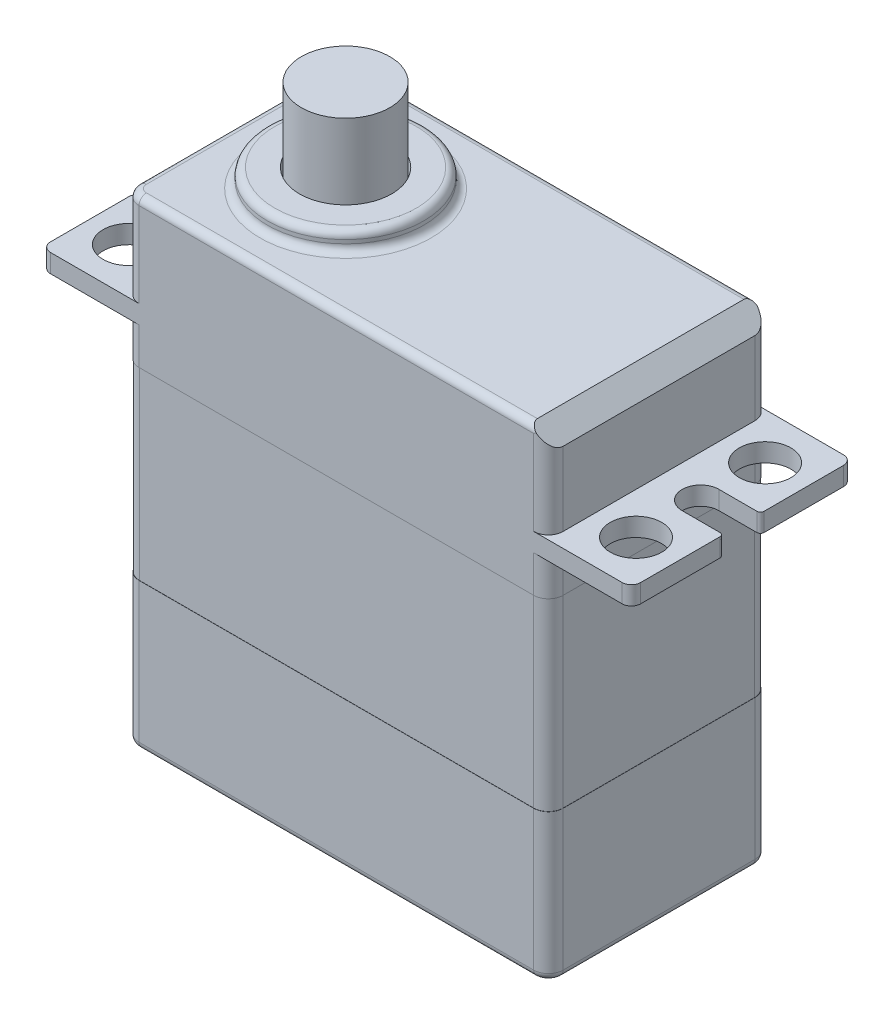
from build123d import *

# Parameters (mm, degrees)
ESBO_O1_W                = 23
ESBO_O1_H                = 12
RESSALTO_EXTRUS_O1_DEPTH = 26
ESBO_O8_W                = 23
ESBO_O8_H                = 12
ESBO_O8_W_2              = 22.98
ESBO_O8_H_2              = 11.98
CORTE_EXTRUS_O3_DEPTH    = 10
ESBO_O2_R                = 4.239559465
RESSALTO_EXTRUS_O2_DEPTH = 1
ESBO_O3_R                = 2.5
CORTE_EXTRUS_O1_DEPTH    = 1
ESBO_O4_R                = 2.4
RESSALTO_EXTRUS_O3_DEPTH = 5
ESBO_O5_W                = 12
ESBO_O5_H                = 1
RESSALTO_EXTRUS_O4_DEPTH = 4.5
ESBO_O6_R                = 1.4
CORTE_EXTRUS_O2_DEPTH    = 4.5
FILETE1_R                = 0.5
FILETE2_R                = 0.2
FILETE1_OF_ESPELHAR1_R   = 0.5
FILETE2_OF_ESPELHAR1_R   = 0.2
FILETE3_R                = 0.8
CHANFRO1_SIZE            = 1
FILETE4_R                = 0.4
FILETE5_R                = 0.4
FILETE6_R                = 0.4


with BuildPart() as part:
    # Esboço1 → Ressalto-extrusão1 (new body)
    with BuildSketch(Plane(origin=(0, 0, 0), x_dir=(1, 0, 0), z_dir=(0, 1, 0))):
        Rectangle(ESBO_O1_W, ESBO_O1_H)
    extrude(amount=RESSALTO_EXTRUS_O1_DEPTH)

    # Esboço8 → Corte-extrusão3 (cut)
    with BuildSketch(Plane(origin=(0, 8, 0), x_dir=(-1, 0, 0), z_dir=(0, -1, 0))):
        Rectangle(ESBO_O8_W, ESBO_O8_H)
        Rectangle(ESBO_O8_W_2, ESBO_O8_H_2, mode=Mode.SUBTRACT)
    extrude(amount=-CORTE_EXTRUS_O3_DEPTH, mode=Mode.SUBTRACT)

    # Esboço2 → Ressalto-extrusão2 (add)
    with BuildSketch(Plane(origin=(0, 26, 0), x_dir=(1, 0, 0), z_dir=(0, 1, 0))):
        with Locations(Location((-5.5, 0, 0), (0, 0, 90))):
            Circle(ESBO_O2_R)
    extrude(amount=RESSALTO_EXTRUS_O2_DEPTH)

    # Esboço3 → Corte-extrusão1 (cut)
    with BuildSketch(Plane(origin=(0, 27, 0), x_dir=(1, 0, 0), z_dir=(0, 1, 0))):
        with Locations(Location((-5.5, 0, 0), (0, 0, 270))):
            Circle(ESBO_O3_R)
    extrude(amount=-CORTE_EXTRUS_O1_DEPTH, mode=Mode.SUBTRACT)

    # Esboço4 → Ressalto-extrusão3 (add)
    with BuildSketch(Plane(origin=(0, 26, 0), x_dir=(1, 0, 0), z_dir=(0, 1, 0))):
        with Locations(Location((-5.5, 0, 0), (0, 0, 270))):
            Circle(ESBO_O4_R)
    extrude(amount=RESSALTO_EXTRUS_O3_DEPTH)

    # Esboço5 → Ressalto-extrusão4 (add)
    with BuildSketch(Plane(origin=(11.5, 0, 0), x_dir=(0, 0, -1), z_dir=(1, 0, 0))):
        with Locations((0, 20.5)):
            Rectangle(ESBO_O5_W, ESBO_O5_H)
    ressalto_extrus_o4 = extrude(amount=RESSALTO_EXTRUS_O4_DEPTH)

    # Esboço6 → Corte-extrusão2 (cut)
    with BuildSketch(Plane(origin=(0, 21, 0), x_dir=(1, 0, 0), z_dir=(0, 1, 0))):
        with Locations(Location((13.75, 3.5, 0), (0, 0, 270))):
            Circle(ESBO_O6_R)
        with Locations(Location((13.75, -3.5, 0), (0, 0, 270))):
            Circle(ESBO_O6_R)
        with BuildLine():
            Line((13.75, 1), (16, 1))
            Line((16, 1), (16, -1))
            Line((16, -1), (13.75, -1))
            ThreePointArc((13.75, -1), (12.75, 0), (13.75, 1))
        make_face()
    corte_extrus_o2 = extrude(amount=-CORTE_EXTRUS_O2_DEPTH, mode=Mode.SUBTRACT)

    # Filete1
    filete1_edges = [part.edges().sort_by_distance(p)[0] for p in [
        (16, 20.5, -6),
        (16, 20.5, 6),
    ]]
    fillet(filete1_edges, radius=FILETE1_R)

    # Filete2
    filete2_edges = [part.edges().sort_by_distance(p)[0] for p in [
        (16, 20.5, 1),
        (16, 20.5, -1),
    ]]
    fillet(filete2_edges, radius=FILETE2_R)

    # Espelhar1: Ressalto-extrusão4, Corte-extrusão2 across plane
    add(ressalto_extrus_o4.mirror(Plane(origin=(0, 0, 0), x_dir=(0, 0, 1), z_dir=(1, 0, 0))))
    add(corte_extrus_o2.mirror(Plane(origin=(0, 0, 0), x_dir=(0, 0, 1), z_dir=(1, 0, 0))), mode=Mode.SUBTRACT)

    # Filete1 of Espelhar1
    filete1_of_espelhar1_edges = [part.edges().sort_by_distance(p)[0] for p in [
        (-16, 20.5, -6),
        (-16, 20.5, 6),
    ]]
    fillet(filete1_of_espelhar1_edges, radius=FILETE1_OF_ESPELHAR1_R)

    # Filete2 of Espelhar1
    filete2_of_espelhar1_edges = [part.edges().sort_by_distance(p)[0] for p in [
        (-16, 20.5, 1),
        (-16, 20.5, -1),
    ]]
    fillet(filete2_of_espelhar1_edges, radius=FILETE2_OF_ESPELHAR1_R)

    # Filete3
    filete3_edges = [part.edges().sort_by_distance(p)[0] for p in [
        (-11.5, 23.5, -6),
        (-11.5, 4, -6),
        (-11.5, 19, -6),
        (11.5, 4, -6),
        (11.5, 19, -6),
        (11.5, 23.5, -6),
        (-11.5, 4, 6),
        (-11.5, 19, 6),
        (-11.5, 23.5, 6),
        (11.5, 23.5, 6),
        (11.5, 4, 6),
        (11.5, 19, 6),
        (-11.49, 13, 5.99),
        (-11.49, 13, -5.99),
        (11.49, 13, -5.99),
        (11.49, 13, 5.99),
    ]]
    fillet(filete3_edges, radius=FILETE3_R)

    # Chanfro1
    # the kernel refuses this chamfer: 1 mm, written as the material it takes off along each edge
    with BuildSketch(Plane(origin=(11.5, 26, 7.771682988), x_dir=(-0.9996219169112968, 0.027495876610585647, 0), z_dir=(0, 0, -1))) as chanfro1_piece_1:
        Polygon((CHANFRO1_SIZE * 0.999621916911, -CHANFRO1_SIZE * 0.0274958766106), (-CHANFRO1_SIZE * 0.0274958766106, -CHANFRO1_SIZE * 0.999621916911), (0, 0), align=None)
    extrude(amount=15.543365976, mode=Mode.SUBTRACT)

    # Filete4
    # the kernel refuses this fillet: 0.4 mm, written as the material it takes off along each edge
    with BuildSketch(Plane(origin=(11.5, 26, -6), x_dir=(0, -1, 0), z_dir=(-1, 0, 0)), Plane(origin=(-10.7, 26, 6), x_dir=(0, -1, 0), z_dir=(1, 0, 0))) as filete4_piece_1:
        with BuildLine():
            CenterArc((FILETE4_R, FILETE4_R), FILETE4_R, 180, 90)
            Line((0, FILETE4_R), (0, 0))
            Line((0, 0), (FILETE4_R, 0))
        make_face()
    extrude(amount=22.2, mode=Mode.SUBTRACT)
    with BuildSketch(Plane(origin=(-10.7, 26, -5.2), x_dir=(0, 0, -1), z_dir=(1, 0, 0))) as filete4_piece_2:
        with BuildLine():
            CenterArc((0.8 - FILETE4_R, -FILETE4_R), FILETE4_R, 0, 90)
            Line((0.8 - FILETE4_R, 0), (0.8, 0))
            Line((0.8, 0), (0.8, -FILETE4_R))
        make_face()
    revolve(axis=Axis((-10.7, 26, -5.2), (0, 1, 0)), revolution_arc=90, mode=Mode.SUBTRACT)
    with BuildSketch(Plane(origin=(-11.5, 26, -5.2), x_dir=(1, 0, 0), z_dir=(0, 0, 1)), Plane(origin=(-11.5, 0, -5.2), x_dir=(0, 1, 0), z_dir=(0, 0, 1)), Plane(origin=(11.5, 0, 5.2), x_dir=(0, 1, 0), z_dir=(0, 0, -1))) as filete4_piece_3:
        with BuildLine():
            CenterArc((FILETE4_R, -FILETE4_R), FILETE4_R, 90, 90)
            Line((0, -FILETE4_R), (0, 0))
            Line((0, 0), (FILETE4_R, 0))
        make_face()
    extrude(amount=10.4, mode=Mode.SUBTRACT)
    with BuildSketch(Plane(origin=(-10.7, 26, 5.2), x_dir=(0, 0, 1), z_dir=(1, 0, 0))) as filete4_piece_4:
        with BuildLine():
            CenterArc((0.8 - FILETE4_R, FILETE4_R), FILETE4_R, 270, 90)
            Line((0.8, FILETE4_R), (0.8, 0))
            Line((0.8, 0), (0.8 - FILETE4_R, 0))
        make_face()
    revolve(axis=Axis((-10.7, 26, 5.2), (0, -1, 0)), revolution_arc=90, mode=Mode.SUBTRACT)
    with BuildSketch(Plane(origin=(10.7, 0, -6), x_dir=(0, 1, 0), z_dir=(-1, 0, 0)), Plane(origin=(-10.7, 0, 6), x_dir=(0, 1, 0), z_dir=(1, 0, 0))) as filete4_piece_5:
        with BuildLine():
            CenterArc((FILETE4_R, -FILETE4_R), FILETE4_R, 90, 90)
            Line((0, -FILETE4_R), (0, 0))
            Line((0, 0), (FILETE4_R, 0))
        make_face()
    extrude(amount=21.4, mode=Mode.SUBTRACT)
    with BuildSketch(Plane(origin=(-10.7, 0, 5.2), x_dir=(0, 0, 1), z_dir=(1, 0, 0))) as filete4_piece_6:
        with BuildLine():
            CenterArc((0.8 - FILETE4_R, -FILETE4_R), FILETE4_R, 0, 90)
            Line((0.8 - FILETE4_R, 0), (0.8, 0))
            Line((0.8, 0), (0.8, -FILETE4_R))
        make_face()
    revolve(axis=Axis((-10.7, 0, 5.2), (0, -1, 0)), revolution_arc=90, mode=Mode.SUBTRACT)
    with BuildSketch(Plane(origin=(-10.7, 0, -5.2), x_dir=(0, 0, -1), z_dir=(1, 0, 0))) as filete4_piece_7:
        with BuildLine():
            CenterArc((0.8 - FILETE4_R, FILETE4_R), FILETE4_R, 270, 90)
            Line((0.8 - FILETE4_R, 0), (0.8, 0))
            Line((0.8, 0), (0.8, FILETE4_R))
        make_face()
    revolve(axis=Axis((-10.7, 0, -5.2), (0, 1, 0)), revolution_arc=90, mode=Mode.SUBTRACT)
    with BuildSketch(Plane(origin=(10.7, 0, -5.2), x_dir=(0, 0, -1), z_dir=(-1, 0, 0))) as filete4_piece_8:
        with BuildLine():
            CenterArc((0.8 - FILETE4_R, -FILETE4_R), FILETE4_R, 0, 90)
            Line((0.8 - FILETE4_R, 0), (0.8, 0))
            Line((0.8, 0), (0.8, -FILETE4_R))
        make_face()
    revolve(axis=Axis((10.7, 0, -5.2), (0, -1, 0)), revolution_arc=90, mode=Mode.SUBTRACT)
    with BuildSketch(Plane(origin=(10.7, 0, 5.2), x_dir=(1, 0, 0), z_dir=(0, 0, -1))) as filete4_piece_9:
        with BuildLine():
            CenterArc((0.8 - FILETE4_R, -FILETE4_R), FILETE4_R, 0, 90)
            Line((0.8 - FILETE4_R, 0), (0.8, 0))
            Line((0.8, 0), (0.8, -FILETE4_R))
        make_face()
    revolve(axis=Axis((10.7, 0, 5.2), (0, -1, 0)), revolution_arc=90, mode=Mode.SUBTRACT)

    # Filete5
    filete5_edges = [part.edges().sort_by_distance(p)[0] for p in [
        (-5.5, 27, 4.239559465),
    ]]
    fillet(filete5_edges, radius=FILETE5_R)

    # Filete6
    filete6_edges = [part.edges().sort_by_distance(p)[0] for p in [
        (-5.5, 26, 4.239559465),
    ]]
    fillet(filete6_edges, radius=FILETE6_R)


solid = part.part
